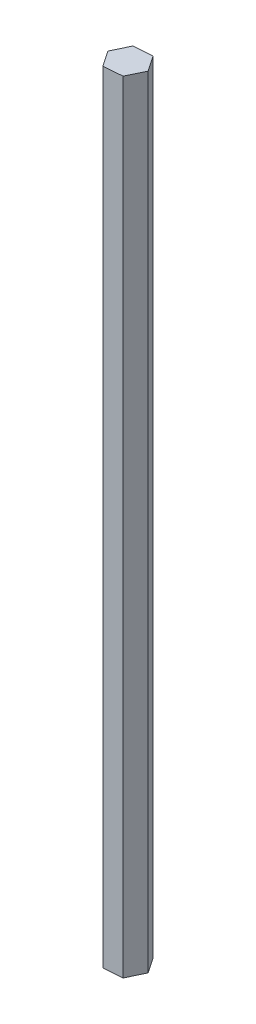
from build123d import *

# Parameters (mm, degrees)
BOSS_EXTRUDE1_DEPTH = 152.4


with BuildPart() as part:
    # Sketch1 → Boss-Extrude1 (new, symmetric)
    with BuildSketch(Plane(origin=(0, 0, 0), x_dir=(1, 0, 0), z_dir=(0, 1, 0))):
        Polygon((7.311389291, 0.554003575), (3.175913476, 6.608850651), (-4.135475816, 6.054847076), (-7.311389291, -0.554003575), (-3.175913476, -6.608850651), (4.135475816, -6.054847076), align=None)
    extrude(amount=BOSS_EXTRUDE1_DEPTH, both=True)


solid = part.part
